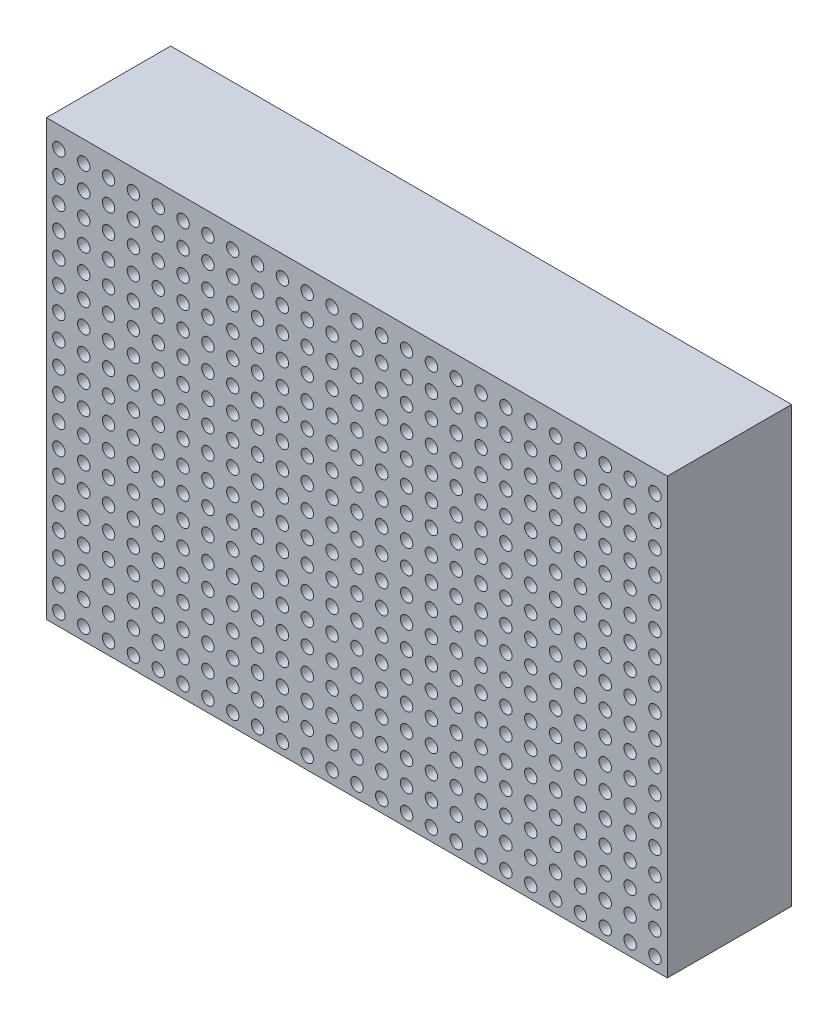
from build123d import *

# Parameters (mm, degrees)
SKETCH1_W           = 50
SKETCH1_H           = 35
BOSS_EXTRUDE1_DEPTH = 10
SKETCH2_R           = 0.5
CUT_EXTRUDE1_DEPTH  = 9.5
LPATTERN1_START     = 0.5
LPATTERN1_OUTLINE_R = 0.5
LPATTERN1_DEPTH     = 9.5


# Read off the part's stored shape, not the designer's step: LPattern1
with BuildPart() as part:
    # Sketch1 → Boss-Extrude1 (new body)
    with BuildSketch(Plane.XY):
        with Locations((25, 17.5)):
            Rectangle(SKETCH1_W, SKETCH1_H)
    extrude(amount=BOSS_EXTRUDE1_DEPTH)

    # Sketch2 → Cut-Extrude1 (cut)
    with BuildSketch(Plane.XY.offset(10)):
        with Locations((1, 1)):
            Circle(SKETCH2_R)
    extrude(amount=-CUT_EXTRUDE1_DEPTH, mode=Mode.SUBTRACT)

    # LPattern1 outline → LPattern1 (cut)
    with BuildSketch(Plane.XY.offset(LPATTERN1_START)):
        with Locations((49, 33.3)):
            Circle(LPATTERN1_OUTLINE_R)
        with Locations((49, 31.4)):
            Circle(LPATTERN1_OUTLINE_R)
        with Locations((49, 29.5)):
            Circle(LPATTERN1_OUTLINE_R)
        with Locations((49, 27.6)):
            Circle(LPATTERN1_OUTLINE_R)
        with Locations((49, 25.7)):
            Circle(LPATTERN1_OUTLINE_R)
        with Locations((49, 23.8)):
            Circle(LPATTERN1_OUTLINE_R)
        with Locations((49, 21.9)):
            Circle(LPATTERN1_OUTLINE_R)
        with Locations((49, 20)):
            Circle(LPATTERN1_OUTLINE_R)
        with Locations((49, 18.1)):
            Circle(LPATTERN1_OUTLINE_R)
        with Locations((49, 16.2)):
            Circle(LPATTERN1_OUTLINE_R)
        with Locations((49, 14.3)):
            Circle(LPATTERN1_OUTLINE_R)
        with Locations((49, 12.4)):
            Circle(LPATTERN1_OUTLINE_R)
        with Locations((49, 10.5)):
            Circle(LPATTERN1_OUTLINE_R)
        with Locations((49, 8.6)):
            Circle(LPATTERN1_OUTLINE_R)
        with Locations((49, 6.7)):
            Circle(LPATTERN1_OUTLINE_R)
        with Locations((49, 4.8)):
            Circle(LPATTERN1_OUTLINE_R)
        with Locations((49, 2.9)):
            Circle(LPATTERN1_OUTLINE_R)
        with Locations((49, 1)):
            Circle(LPATTERN1_OUTLINE_R)
        with Locations((47, 33.3)):
            Circle(LPATTERN1_OUTLINE_R)
        with Locations((47, 31.4)):
            Circle(LPATTERN1_OUTLINE_R)
        with Locations((47, 29.5)):
            Circle(LPATTERN1_OUTLINE_R)
        with Locations((47, 27.6)):
            Circle(LPATTERN1_OUTLINE_R)
        with Locations((47, 25.7)):
            Circle(LPATTERN1_OUTLINE_R)
        with Locations((47, 23.8)):
            Circle(LPATTERN1_OUTLINE_R)
        with Locations((47, 21.9)):
            Circle(LPATTERN1_OUTLINE_R)
        with Locations((47, 20)):
            Circle(LPATTERN1_OUTLINE_R)
        with Locations((47, 18.1)):
            Circle(LPATTERN1_OUTLINE_R)
        with Locations((47, 16.2)):
            Circle(LPATTERN1_OUTLINE_R)
        with Locations((47, 14.3)):
            Circle(LPATTERN1_OUTLINE_R)
        with Locations((47, 12.4)):
            Circle(LPATTERN1_OUTLINE_R)
        with Locations((47, 10.5)):
            Circle(LPATTERN1_OUTLINE_R)
        with Locations((47, 8.6)):
            Circle(LPATTERN1_OUTLINE_R)
        with Locations((47, 6.7)):
            Circle(LPATTERN1_OUTLINE_R)
        with Locations((47, 4.8)):
            Circle(LPATTERN1_OUTLINE_R)
        with Locations((47, 2.9)):
            Circle(LPATTERN1_OUTLINE_R)
        with Locations((47, 1)):
            Circle(LPATTERN1_OUTLINE_R)
        with Locations((45, 33.3)):
            Circle(LPATTERN1_OUTLINE_R)
        with Locations((45, 31.4)):
            Circle(LPATTERN1_OUTLINE_R)
        with Locations((45, 29.5)):
            Circle(LPATTERN1_OUTLINE_R)
        with Locations((45, 27.6)):
            Circle(LPATTERN1_OUTLINE_R)
        with Locations((45, 25.7)):
            Circle(LPATTERN1_OUTLINE_R)
        with Locations((45, 23.8)):
            Circle(LPATTERN1_OUTLINE_R)
        with Locations((45, 21.9)):
            Circle(LPATTERN1_OUTLINE_R)
        with Locations((45, 20)):
            Circle(LPATTERN1_OUTLINE_R)
        with Locations((45, 18.1)):
            Circle(LPATTERN1_OUTLINE_R)
        with Locations((45, 16.2)):
            Circle(LPATTERN1_OUTLINE_R)
        with Locations((45, 14.3)):
            Circle(LPATTERN1_OUTLINE_R)
        with Locations((45, 12.4)):
            Circle(LPATTERN1_OUTLINE_R)
        with Locations((45, 10.5)):
            Circle(LPATTERN1_OUTLINE_R)
        with Locations((45, 8.6)):
            Circle(LPATTERN1_OUTLINE_R)
        with Locations((45, 6.7)):
            Circle(LPATTERN1_OUTLINE_R)
        with Locations((45, 4.8)):
            Circle(LPATTERN1_OUTLINE_R)
        with Locations((45, 2.9)):
            Circle(LPATTERN1_OUTLINE_R)
        with Locations((45, 1)):
            Circle(LPATTERN1_OUTLINE_R)
        with Locations((43, 33.3)):
            Circle(LPATTERN1_OUTLINE_R)
        with Locations((43, 31.4)):
            Circle(LPATTERN1_OUTLINE_R)
        with Locations((43, 29.5)):
            Circle(LPATTERN1_OUTLINE_R)
        with Locations((43, 27.6)):
            Circle(LPATTERN1_OUTLINE_R)
        with Locations((43, 25.7)):
            Circle(LPATTERN1_OUTLINE_R)
        with Locations((43, 23.8)):
            Circle(LPATTERN1_OUTLINE_R)
        with Locations((43, 21.9)):
            Circle(LPATTERN1_OUTLINE_R)
        with Locations((43, 20)):
            Circle(LPATTERN1_OUTLINE_R)
        with Locations((43, 18.1)):
            Circle(LPATTERN1_OUTLINE_R)
        with Locations((43, 16.2)):
            Circle(LPATTERN1_OUTLINE_R)
        with Locations((43, 14.3)):
            Circle(LPATTERN1_OUTLINE_R)
        with Locations((43, 12.4)):
            Circle(LPATTERN1_OUTLINE_R)
        with Locations((43, 10.5)):
            Circle(LPATTERN1_OUTLINE_R)
        with Locations((43, 8.6)):
            Circle(LPATTERN1_OUTLINE_R)
        with Locations((43, 6.7)):
            Circle(LPATTERN1_OUTLINE_R)
        with Locations((43, 4.8)):
            Circle(LPATTERN1_OUTLINE_R)
        with Locations((43, 2.9)):
            Circle(LPATTERN1_OUTLINE_R)
        with Locations((43, 1)):
            Circle(LPATTERN1_OUTLINE_R)
        with Locations((41, 33.3)):
            Circle(LPATTERN1_OUTLINE_R)
        with Locations((41, 31.4)):
            Circle(LPATTERN1_OUTLINE_R)
        with Locations((41, 29.5)):
            Circle(LPATTERN1_OUTLINE_R)
        with Locations((41, 27.6)):
            Circle(LPATTERN1_OUTLINE_R)
        with Locations((41, 25.7)):
            Circle(LPATTERN1_OUTLINE_R)
        with Locations((41, 23.8)):
            Circle(LPATTERN1_OUTLINE_R)
        with Locations((41, 21.9)):
            Circle(LPATTERN1_OUTLINE_R)
        with Locations((41, 20)):
            Circle(LPATTERN1_OUTLINE_R)
        with Locations((41, 18.1)):
            Circle(LPATTERN1_OUTLINE_R)
        with Locations((41, 16.2)):
            Circle(LPATTERN1_OUTLINE_R)
        with Locations((41, 14.3)):
            Circle(LPATTERN1_OUTLINE_R)
        with Locations((41, 12.4)):
            Circle(LPATTERN1_OUTLINE_R)
        with Locations((41, 10.5)):
            Circle(LPATTERN1_OUTLINE_R)
        with Locations((41, 8.6)):
            Circle(LPATTERN1_OUTLINE_R)
        with Locations((41, 6.7)):
            Circle(LPATTERN1_OUTLINE_R)
        with Locations((41, 4.8)):
            Circle(LPATTERN1_OUTLINE_R)
        with Locations((41, 2.9)):
            Circle(LPATTERN1_OUTLINE_R)
        with Locations((41, 1)):
            Circle(LPATTERN1_OUTLINE_R)
        with Locations((39, 33.3)):
            Circle(LPATTERN1_OUTLINE_R)
        with Locations((39, 31.4)):
            Circle(LPATTERN1_OUTLINE_R)
        with Locations((39, 29.5)):
            Circle(LPATTERN1_OUTLINE_R)
        with Locations((39, 27.6)):
            Circle(LPATTERN1_OUTLINE_R)
        with Locations((39, 25.7)):
            Circle(LPATTERN1_OUTLINE_R)
        with Locations((39, 23.8)):
            Circle(LPATTERN1_OUTLINE_R)
        with Locations((39, 21.9)):
            Circle(LPATTERN1_OUTLINE_R)
        with Locations((39, 20)):
            Circle(LPATTERN1_OUTLINE_R)
        with Locations((39, 18.1)):
            Circle(LPATTERN1_OUTLINE_R)
        with Locations((39, 16.2)):
            Circle(LPATTERN1_OUTLINE_R)
        with Locations((39, 14.3)):
            Circle(LPATTERN1_OUTLINE_R)
        with Locations((39, 12.4)):
            Circle(LPATTERN1_OUTLINE_R)
        with Locations((39, 10.5)):
            Circle(LPATTERN1_OUTLINE_R)
        with Locations((39, 8.6)):
            Circle(LPATTERN1_OUTLINE_R)
        with Locations((39, 6.7)):
            Circle(LPATTERN1_OUTLINE_R)
        with Locations((39, 4.8)):
            Circle(LPATTERN1_OUTLINE_R)
        with Locations((39, 2.9)):
            Circle(LPATTERN1_OUTLINE_R)
        with Locations((39, 1)):
            Circle(LPATTERN1_OUTLINE_R)
        with Locations((37, 33.3)):
            Circle(LPATTERN1_OUTLINE_R)
        with Locations((37, 31.4)):
            Circle(LPATTERN1_OUTLINE_R)
        with Locations((37, 29.5)):
            Circle(LPATTERN1_OUTLINE_R)
        with Locations((37, 27.6)):
            Circle(LPATTERN1_OUTLINE_R)
        with Locations((37, 25.7)):
            Circle(LPATTERN1_OUTLINE_R)
        with Locations((37, 23.8)):
            Circle(LPATTERN1_OUTLINE_R)
        with Locations((37, 21.9)):
            Circle(LPATTERN1_OUTLINE_R)
        with Locations((37, 20)):
            Circle(LPATTERN1_OUTLINE_R)
        with Locations((37, 18.1)):
            Circle(LPATTERN1_OUTLINE_R)
        with Locations((37, 16.2)):
            Circle(LPATTERN1_OUTLINE_R)
        with Locations((37, 14.3)):
            Circle(LPATTERN1_OUTLINE_R)
        with Locations((37, 12.4)):
            Circle(LPATTERN1_OUTLINE_R)
        with Locations((37, 10.5)):
            Circle(LPATTERN1_OUTLINE_R)
        with Locations((37, 8.6)):
            Circle(LPATTERN1_OUTLINE_R)
        with Locations((37, 6.7)):
            Circle(LPATTERN1_OUTLINE_R)
        with Locations((37, 4.8)):
            Circle(LPATTERN1_OUTLINE_R)
        with Locations((37, 2.9)):
            Circle(LPATTERN1_OUTLINE_R)
        with Locations((37, 1)):
            Circle(LPATTERN1_OUTLINE_R)
        with Locations((35, 33.3)):
            Circle(LPATTERN1_OUTLINE_R)
        with Locations((35, 31.4)):
            Circle(LPATTERN1_OUTLINE_R)
        with Locations((35, 29.5)):
            Circle(LPATTERN1_OUTLINE_R)
        with Locations((35, 27.6)):
            Circle(LPATTERN1_OUTLINE_R)
        with Locations((35, 25.7)):
            Circle(LPATTERN1_OUTLINE_R)
        with Locations((35, 23.8)):
            Circle(LPATTERN1_OUTLINE_R)
        with Locations((35, 21.9)):
            Circle(LPATTERN1_OUTLINE_R)
        with Locations((35, 20)):
            Circle(LPATTERN1_OUTLINE_R)
        with Locations((35, 18.1)):
            Circle(LPATTERN1_OUTLINE_R)
        with Locations((35, 16.2)):
            Circle(LPATTERN1_OUTLINE_R)
        with Locations((35, 14.3)):
            Circle(LPATTERN1_OUTLINE_R)
        with Locations((35, 12.4)):
            Circle(LPATTERN1_OUTLINE_R)
        with Locations((35, 10.5)):
            Circle(LPATTERN1_OUTLINE_R)
        with Locations((35, 8.6)):
            Circle(LPATTERN1_OUTLINE_R)
        with Locations((35, 6.7)):
            Circle(LPATTERN1_OUTLINE_R)
        with Locations((35, 4.8)):
            Circle(LPATTERN1_OUTLINE_R)
        with Locations((35, 2.9)):
            Circle(LPATTERN1_OUTLINE_R)
        with Locations((35, 1)):
            Circle(LPATTERN1_OUTLINE_R)
        with Locations((33, 33.3)):
            Circle(LPATTERN1_OUTLINE_R)
        with Locations((33, 31.4)):
            Circle(LPATTERN1_OUTLINE_R)
        with Locations((33, 29.5)):
            Circle(LPATTERN1_OUTLINE_R)
        with Locations((33, 27.6)):
            Circle(LPATTERN1_OUTLINE_R)
        with Locations((33, 25.7)):
            Circle(LPATTERN1_OUTLINE_R)
        with Locations((33, 23.8)):
            Circle(LPATTERN1_OUTLINE_R)
        with Locations((33, 21.9)):
            Circle(LPATTERN1_OUTLINE_R)
        with Locations((33, 20)):
            Circle(LPATTERN1_OUTLINE_R)
        with Locations((33, 18.1)):
            Circle(LPATTERN1_OUTLINE_R)
        with Locations((33, 16.2)):
            Circle(LPATTERN1_OUTLINE_R)
        with Locations((33, 14.3)):
            Circle(LPATTERN1_OUTLINE_R)
        with Locations((33, 12.4)):
            Circle(LPATTERN1_OUTLINE_R)
        with Locations((33, 10.5)):
            Circle(LPATTERN1_OUTLINE_R)
        with Locations((33, 8.6)):
            Circle(LPATTERN1_OUTLINE_R)
        with Locations((33, 6.7)):
            Circle(LPATTERN1_OUTLINE_R)
        with Locations((33, 4.8)):
            Circle(LPATTERN1_OUTLINE_R)
        with Locations((33, 2.9)):
            Circle(LPATTERN1_OUTLINE_R)
        with Locations((33, 1)):
            Circle(LPATTERN1_OUTLINE_R)
        with Locations((31, 33.3)):
            Circle(LPATTERN1_OUTLINE_R)
        with Locations((31, 31.4)):
            Circle(LPATTERN1_OUTLINE_R)
        with Locations((31, 29.5)):
            Circle(LPATTERN1_OUTLINE_R)
        with Locations((31, 27.6)):
            Circle(LPATTERN1_OUTLINE_R)
        with Locations((31, 25.7)):
            Circle(LPATTERN1_OUTLINE_R)
        with Locations((31, 23.8)):
            Circle(LPATTERN1_OUTLINE_R)
        with Locations((31, 21.9)):
            Circle(LPATTERN1_OUTLINE_R)
        with Locations((31, 20)):
            Circle(LPATTERN1_OUTLINE_R)
        with Locations((31, 18.1)):
            Circle(LPATTERN1_OUTLINE_R)
        with Locations((31, 16.2)):
            Circle(LPATTERN1_OUTLINE_R)
        with Locations((31, 14.3)):
            Circle(LPATTERN1_OUTLINE_R)
        with Locations((31, 12.4)):
            Circle(LPATTERN1_OUTLINE_R)
        with Locations((31, 10.5)):
            Circle(LPATTERN1_OUTLINE_R)
        with Locations((31, 8.6)):
            Circle(LPATTERN1_OUTLINE_R)
        with Locations((31, 6.7)):
            Circle(LPATTERN1_OUTLINE_R)
        with Locations((31, 4.8)):
            Circle(LPATTERN1_OUTLINE_R)
        with Locations((31, 2.9)):
            Circle(LPATTERN1_OUTLINE_R)
        with Locations((31, 1)):
            Circle(LPATTERN1_OUTLINE_R)
        with Locations((29, 33.3)):
            Circle(LPATTERN1_OUTLINE_R)
        with Locations((29, 31.4)):
            Circle(LPATTERN1_OUTLINE_R)
        with Locations((29, 29.5)):
            Circle(LPATTERN1_OUTLINE_R)
        with Locations((29, 27.6)):
            Circle(LPATTERN1_OUTLINE_R)
        with Locations((29, 25.7)):
            Circle(LPATTERN1_OUTLINE_R)
        with Locations((29, 23.8)):
            Circle(LPATTERN1_OUTLINE_R)
        with Locations((29, 21.9)):
            Circle(LPATTERN1_OUTLINE_R)
        with Locations((29, 20)):
            Circle(LPATTERN1_OUTLINE_R)
        with Locations((29, 18.1)):
            Circle(LPATTERN1_OUTLINE_R)
        with Locations((29, 16.2)):
            Circle(LPATTERN1_OUTLINE_R)
        with Locations((29, 14.3)):
            Circle(LPATTERN1_OUTLINE_R)
        with Locations((29, 12.4)):
            Circle(LPATTERN1_OUTLINE_R)
        with Locations((29, 10.5)):
            Circle(LPATTERN1_OUTLINE_R)
        with Locations((29, 8.6)):
            Circle(LPATTERN1_OUTLINE_R)
        with Locations((29, 6.7)):
            Circle(LPATTERN1_OUTLINE_R)
        with Locations((29, 4.8)):
            Circle(LPATTERN1_OUTLINE_R)
        with Locations((29, 2.9)):
            Circle(LPATTERN1_OUTLINE_R)
        with Locations((29, 1)):
            Circle(LPATTERN1_OUTLINE_R)
        with Locations((27, 33.3)):
            Circle(LPATTERN1_OUTLINE_R)
        with Locations((27, 31.4)):
            Circle(LPATTERN1_OUTLINE_R)
        with Locations((27, 29.5)):
            Circle(LPATTERN1_OUTLINE_R)
        with Locations((27, 27.6)):
            Circle(LPATTERN1_OUTLINE_R)
        with Locations((27, 25.7)):
            Circle(LPATTERN1_OUTLINE_R)
        with Locations((27, 23.8)):
            Circle(LPATTERN1_OUTLINE_R)
        with Locations((27, 21.9)):
            Circle(LPATTERN1_OUTLINE_R)
        with Locations((27, 20)):
            Circle(LPATTERN1_OUTLINE_R)
        with Locations((27, 18.1)):
            Circle(LPATTERN1_OUTLINE_R)
        with Locations((27, 16.2)):
            Circle(LPATTERN1_OUTLINE_R)
        with Locations((27, 14.3)):
            Circle(LPATTERN1_OUTLINE_R)
        with Locations((27, 12.4)):
            Circle(LPATTERN1_OUTLINE_R)
        with Locations((27, 10.5)):
            Circle(LPATTERN1_OUTLINE_R)
        with Locations((27, 8.6)):
            Circle(LPATTERN1_OUTLINE_R)
        with Locations((27, 6.7)):
            Circle(LPATTERN1_OUTLINE_R)
        with Locations((27, 4.8)):
            Circle(LPATTERN1_OUTLINE_R)
        with Locations((27, 2.9)):
            Circle(LPATTERN1_OUTLINE_R)
        with Locations((27, 1)):
            Circle(LPATTERN1_OUTLINE_R)
        with Locations((25, 33.3)):
            Circle(LPATTERN1_OUTLINE_R)
        with Locations((25, 31.4)):
            Circle(LPATTERN1_OUTLINE_R)
        with Locations((25, 29.5)):
            Circle(LPATTERN1_OUTLINE_R)
        with Locations((25, 27.6)):
            Circle(LPATTERN1_OUTLINE_R)
        with Locations((25, 25.7)):
            Circle(LPATTERN1_OUTLINE_R)
        with Locations((25, 23.8)):
            Circle(LPATTERN1_OUTLINE_R)
        with Locations((25, 21.9)):
            Circle(LPATTERN1_OUTLINE_R)
        with Locations((25, 20)):
            Circle(LPATTERN1_OUTLINE_R)
        with Locations((25, 18.1)):
            Circle(LPATTERN1_OUTLINE_R)
        with Locations((25, 16.2)):
            Circle(LPATTERN1_OUTLINE_R)
        with Locations((25, 14.3)):
            Circle(LPATTERN1_OUTLINE_R)
        with Locations((25, 12.4)):
            Circle(LPATTERN1_OUTLINE_R)
        with Locations((25, 10.5)):
            Circle(LPATTERN1_OUTLINE_R)
        with Locations((25, 8.6)):
            Circle(LPATTERN1_OUTLINE_R)
        with Locations((25, 6.7)):
            Circle(LPATTERN1_OUTLINE_R)
        with Locations((25, 4.8)):
            Circle(LPATTERN1_OUTLINE_R)
        with Locations((25, 2.9)):
            Circle(LPATTERN1_OUTLINE_R)
        with Locations((25, 1)):
            Circle(LPATTERN1_OUTLINE_R)
        with Locations((23, 33.3)):
            Circle(LPATTERN1_OUTLINE_R)
        with Locations((23, 31.4)):
            Circle(LPATTERN1_OUTLINE_R)
        with Locations((23, 29.5)):
            Circle(LPATTERN1_OUTLINE_R)
        with Locations((23, 27.6)):
            Circle(LPATTERN1_OUTLINE_R)
        with Locations((23, 25.7)):
            Circle(LPATTERN1_OUTLINE_R)
        with Locations((23, 23.8)):
            Circle(LPATTERN1_OUTLINE_R)
        with Locations((23, 21.9)):
            Circle(LPATTERN1_OUTLINE_R)
        with Locations((23, 20)):
            Circle(LPATTERN1_OUTLINE_R)
        with Locations((23, 18.1)):
            Circle(LPATTERN1_OUTLINE_R)
        with Locations((23, 16.2)):
            Circle(LPATTERN1_OUTLINE_R)
        with Locations((23, 14.3)):
            Circle(LPATTERN1_OUTLINE_R)
        with Locations((23, 12.4)):
            Circle(LPATTERN1_OUTLINE_R)
        with Locations((23, 10.5)):
            Circle(LPATTERN1_OUTLINE_R)
        with Locations((23, 8.6)):
            Circle(LPATTERN1_OUTLINE_R)
        with Locations((23, 6.7)):
            Circle(LPATTERN1_OUTLINE_R)
        with Locations((23, 4.8)):
            Circle(LPATTERN1_OUTLINE_R)
        with Locations((23, 2.9)):
            Circle(LPATTERN1_OUTLINE_R)
        with Locations((23, 1)):
            Circle(LPATTERN1_OUTLINE_R)
        with Locations((21, 33.3)):
            Circle(LPATTERN1_OUTLINE_R)
        with Locations((21, 31.4)):
            Circle(LPATTERN1_OUTLINE_R)
        with Locations((21, 29.5)):
            Circle(LPATTERN1_OUTLINE_R)
        with Locations((21, 27.6)):
            Circle(LPATTERN1_OUTLINE_R)
        with Locations((21, 25.7)):
            Circle(LPATTERN1_OUTLINE_R)
        with Locations((21, 23.8)):
            Circle(LPATTERN1_OUTLINE_R)
        with Locations((21, 21.9)):
            Circle(LPATTERN1_OUTLINE_R)
        with Locations((21, 20)):
            Circle(LPATTERN1_OUTLINE_R)
        with Locations((21, 18.1)):
            Circle(LPATTERN1_OUTLINE_R)
        with Locations((21, 16.2)):
            Circle(LPATTERN1_OUTLINE_R)
        with Locations((21, 14.3)):
            Circle(LPATTERN1_OUTLINE_R)
        with Locations((21, 12.4)):
            Circle(LPATTERN1_OUTLINE_R)
        with Locations((21, 10.5)):
            Circle(LPATTERN1_OUTLINE_R)
        with Locations((21, 8.6)):
            Circle(LPATTERN1_OUTLINE_R)
        with Locations((21, 6.7)):
            Circle(LPATTERN1_OUTLINE_R)
        with Locations((21, 4.8)):
            Circle(LPATTERN1_OUTLINE_R)
        with Locations((21, 2.9)):
            Circle(LPATTERN1_OUTLINE_R)
        with Locations((21, 1)):
            Circle(LPATTERN1_OUTLINE_R)
        with Locations((19, 33.3)):
            Circle(LPATTERN1_OUTLINE_R)
        with Locations((19, 31.4)):
            Circle(LPATTERN1_OUTLINE_R)
        with Locations((19, 29.5)):
            Circle(LPATTERN1_OUTLINE_R)
        with Locations((19, 27.6)):
            Circle(LPATTERN1_OUTLINE_R)
        with Locations((19, 25.7)):
            Circle(LPATTERN1_OUTLINE_R)
        with Locations((19, 23.8)):
            Circle(LPATTERN1_OUTLINE_R)
        with Locations((19, 21.9)):
            Circle(LPATTERN1_OUTLINE_R)
        with Locations((19, 20)):
            Circle(LPATTERN1_OUTLINE_R)
        with Locations((19, 18.1)):
            Circle(LPATTERN1_OUTLINE_R)
        with Locations((19, 16.2)):
            Circle(LPATTERN1_OUTLINE_R)
        with Locations((19, 14.3)):
            Circle(LPATTERN1_OUTLINE_R)
        with Locations((19, 12.4)):
            Circle(LPATTERN1_OUTLINE_R)
        with Locations((19, 10.5)):
            Circle(LPATTERN1_OUTLINE_R)
        with Locations((19, 8.6)):
            Circle(LPATTERN1_OUTLINE_R)
        with Locations((19, 6.7)):
            Circle(LPATTERN1_OUTLINE_R)
        with Locations((19, 4.8)):
            Circle(LPATTERN1_OUTLINE_R)
        with Locations((19, 2.9)):
            Circle(LPATTERN1_OUTLINE_R)
        with Locations((19, 1)):
            Circle(LPATTERN1_OUTLINE_R)
        with Locations((17, 33.3)):
            Circle(LPATTERN1_OUTLINE_R)
        with Locations((17, 31.4)):
            Circle(LPATTERN1_OUTLINE_R)
        with Locations((17, 29.5)):
            Circle(LPATTERN1_OUTLINE_R)
        with Locations((17, 27.6)):
            Circle(LPATTERN1_OUTLINE_R)
        with Locations((17, 25.7)):
            Circle(LPATTERN1_OUTLINE_R)
        with Locations((17, 23.8)):
            Circle(LPATTERN1_OUTLINE_R)
        with Locations((17, 21.9)):
            Circle(LPATTERN1_OUTLINE_R)
        with Locations((17, 20)):
            Circle(LPATTERN1_OUTLINE_R)
        with Locations((17, 18.1)):
            Circle(LPATTERN1_OUTLINE_R)
        with Locations((17, 16.2)):
            Circle(LPATTERN1_OUTLINE_R)
        with Locations((17, 14.3)):
            Circle(LPATTERN1_OUTLINE_R)
        with Locations((17, 12.4)):
            Circle(LPATTERN1_OUTLINE_R)
        with Locations((17, 10.5)):
            Circle(LPATTERN1_OUTLINE_R)
        with Locations((17, 8.6)):
            Circle(LPATTERN1_OUTLINE_R)
        with Locations((17, 6.7)):
            Circle(LPATTERN1_OUTLINE_R)
        with Locations((17, 4.8)):
            Circle(LPATTERN1_OUTLINE_R)
        with Locations((17, 2.9)):
            Circle(LPATTERN1_OUTLINE_R)
        with Locations((17, 1)):
            Circle(LPATTERN1_OUTLINE_R)
        with Locations((15, 33.3)):
            Circle(LPATTERN1_OUTLINE_R)
        with Locations((15, 31.4)):
            Circle(LPATTERN1_OUTLINE_R)
        with Locations((15, 29.5)):
            Circle(LPATTERN1_OUTLINE_R)
        with Locations((15, 27.6)):
            Circle(LPATTERN1_OUTLINE_R)
        with Locations((15, 25.7)):
            Circle(LPATTERN1_OUTLINE_R)
        with Locations((15, 23.8)):
            Circle(LPATTERN1_OUTLINE_R)
        with Locations((15, 21.9)):
            Circle(LPATTERN1_OUTLINE_R)
        with Locations((15, 20)):
            Circle(LPATTERN1_OUTLINE_R)
        with Locations((15, 18.1)):
            Circle(LPATTERN1_OUTLINE_R)
        with Locations((15, 16.2)):
            Circle(LPATTERN1_OUTLINE_R)
        with Locations((15, 14.3)):
            Circle(LPATTERN1_OUTLINE_R)
        with Locations((15, 12.4)):
            Circle(LPATTERN1_OUTLINE_R)
        with Locations((15, 10.5)):
            Circle(LPATTERN1_OUTLINE_R)
        with Locations((15, 8.6)):
            Circle(LPATTERN1_OUTLINE_R)
        with Locations((15, 6.7)):
            Circle(LPATTERN1_OUTLINE_R)
        with Locations((15, 4.8)):
            Circle(LPATTERN1_OUTLINE_R)
        with Locations((15, 2.9)):
            Circle(LPATTERN1_OUTLINE_R)
        with Locations((15, 1)):
            Circle(LPATTERN1_OUTLINE_R)
        with Locations((13, 33.3)):
            Circle(LPATTERN1_OUTLINE_R)
        with Locations((13, 31.4)):
            Circle(LPATTERN1_OUTLINE_R)
        with Locations((13, 29.5)):
            Circle(LPATTERN1_OUTLINE_R)
        with Locations((13, 27.6)):
            Circle(LPATTERN1_OUTLINE_R)
        with Locations((13, 25.7)):
            Circle(LPATTERN1_OUTLINE_R)
        with Locations((13, 23.8)):
            Circle(LPATTERN1_OUTLINE_R)
        with Locations((13, 21.9)):
            Circle(LPATTERN1_OUTLINE_R)
        with Locations((13, 20)):
            Circle(LPATTERN1_OUTLINE_R)
        with Locations((13, 18.1)):
            Circle(LPATTERN1_OUTLINE_R)
        with Locations((13, 16.2)):
            Circle(LPATTERN1_OUTLINE_R)
        with Locations((13, 14.3)):
            Circle(LPATTERN1_OUTLINE_R)
        with Locations((13, 12.4)):
            Circle(LPATTERN1_OUTLINE_R)
        with Locations((13, 10.5)):
            Circle(LPATTERN1_OUTLINE_R)
        with Locations((13, 8.6)):
            Circle(LPATTERN1_OUTLINE_R)
        with Locations((13, 6.7)):
            Circle(LPATTERN1_OUTLINE_R)
        with Locations((13, 4.8)):
            Circle(LPATTERN1_OUTLINE_R)
        with Locations((13, 2.9)):
            Circle(LPATTERN1_OUTLINE_R)
        with Locations((13, 1)):
            Circle(LPATTERN1_OUTLINE_R)
        with Locations((11, 33.3)):
            Circle(LPATTERN1_OUTLINE_R)
        with Locations((11, 31.4)):
            Circle(LPATTERN1_OUTLINE_R)
        with Locations((11, 29.5)):
            Circle(LPATTERN1_OUTLINE_R)
        with Locations((11, 27.6)):
            Circle(LPATTERN1_OUTLINE_R)
        with Locations((11, 25.7)):
            Circle(LPATTERN1_OUTLINE_R)
        with Locations((11, 23.8)):
            Circle(LPATTERN1_OUTLINE_R)
        with Locations((11, 21.9)):
            Circle(LPATTERN1_OUTLINE_R)
        with Locations((11, 20)):
            Circle(LPATTERN1_OUTLINE_R)
        with Locations((11, 18.1)):
            Circle(LPATTERN1_OUTLINE_R)
        with Locations((11, 16.2)):
            Circle(LPATTERN1_OUTLINE_R)
        with Locations((11, 14.3)):
            Circle(LPATTERN1_OUTLINE_R)
        with Locations((11, 12.4)):
            Circle(LPATTERN1_OUTLINE_R)
        with Locations((11, 10.5)):
            Circle(LPATTERN1_OUTLINE_R)
        with Locations((11, 8.6)):
            Circle(LPATTERN1_OUTLINE_R)
        with Locations((11, 6.7)):
            Circle(LPATTERN1_OUTLINE_R)
        with Locations((11, 4.8)):
            Circle(LPATTERN1_OUTLINE_R)
        with Locations((11, 2.9)):
            Circle(LPATTERN1_OUTLINE_R)
        with Locations((11, 1)):
            Circle(LPATTERN1_OUTLINE_R)
        with Locations((9, 33.3)):
            Circle(LPATTERN1_OUTLINE_R)
        with Locations((9, 31.4)):
            Circle(LPATTERN1_OUTLINE_R)
        with Locations((9, 29.5)):
            Circle(LPATTERN1_OUTLINE_R)
        with Locations((9, 27.6)):
            Circle(LPATTERN1_OUTLINE_R)
        with Locations((9, 25.7)):
            Circle(LPATTERN1_OUTLINE_R)
        with Locations((9, 23.8)):
            Circle(LPATTERN1_OUTLINE_R)
        with Locations((9, 21.9)):
            Circle(LPATTERN1_OUTLINE_R)
        with Locations((9, 20)):
            Circle(LPATTERN1_OUTLINE_R)
        with Locations((9, 18.1)):
            Circle(LPATTERN1_OUTLINE_R)
        with Locations((9, 16.2)):
            Circle(LPATTERN1_OUTLINE_R)
        with Locations((9, 14.3)):
            Circle(LPATTERN1_OUTLINE_R)
        with Locations((9, 12.4)):
            Circle(LPATTERN1_OUTLINE_R)
        with Locations((9, 10.5)):
            Circle(LPATTERN1_OUTLINE_R)
        with Locations((9, 8.6)):
            Circle(LPATTERN1_OUTLINE_R)
        with Locations((9, 6.7)):
            Circle(LPATTERN1_OUTLINE_R)
        with Locations((9, 4.8)):
            Circle(LPATTERN1_OUTLINE_R)
        with Locations((9, 2.9)):
            Circle(LPATTERN1_OUTLINE_R)
        with Locations((9, 1)):
            Circle(LPATTERN1_OUTLINE_R)
        with Locations((7, 33.3)):
            Circle(LPATTERN1_OUTLINE_R)
        with Locations((7, 31.4)):
            Circle(LPATTERN1_OUTLINE_R)
        with Locations((7, 29.5)):
            Circle(LPATTERN1_OUTLINE_R)
        with Locations((7, 27.6)):
            Circle(LPATTERN1_OUTLINE_R)
        with Locations((7, 25.7)):
            Circle(LPATTERN1_OUTLINE_R)
        with Locations((7, 23.8)):
            Circle(LPATTERN1_OUTLINE_R)
        with Locations((7, 21.9)):
            Circle(LPATTERN1_OUTLINE_R)
        with Locations((7, 20)):
            Circle(LPATTERN1_OUTLINE_R)
        with Locations((7, 18.1)):
            Circle(LPATTERN1_OUTLINE_R)
        with Locations((7, 16.2)):
            Circle(LPATTERN1_OUTLINE_R)
        with Locations((7, 14.3)):
            Circle(LPATTERN1_OUTLINE_R)
        with Locations((7, 12.4)):
            Circle(LPATTERN1_OUTLINE_R)
        with Locations((7, 10.5)):
            Circle(LPATTERN1_OUTLINE_R)
        with Locations((7, 8.6)):
            Circle(LPATTERN1_OUTLINE_R)
        with Locations((7, 6.7)):
            Circle(LPATTERN1_OUTLINE_R)
        with Locations((7, 4.8)):
            Circle(LPATTERN1_OUTLINE_R)
        with Locations((7, 2.9)):
            Circle(LPATTERN1_OUTLINE_R)
        with Locations((7, 1)):
            Circle(LPATTERN1_OUTLINE_R)
        with Locations((5, 33.3)):
            Circle(LPATTERN1_OUTLINE_R)
        with Locations((5, 31.4)):
            Circle(LPATTERN1_OUTLINE_R)
        with Locations((5, 29.5)):
            Circle(LPATTERN1_OUTLINE_R)
        with Locations((5, 27.6)):
            Circle(LPATTERN1_OUTLINE_R)
        with Locations((5, 25.7)):
            Circle(LPATTERN1_OUTLINE_R)
        with Locations((5, 23.8)):
            Circle(LPATTERN1_OUTLINE_R)
        with Locations((5, 21.9)):
            Circle(LPATTERN1_OUTLINE_R)
        with Locations((5, 20)):
            Circle(LPATTERN1_OUTLINE_R)
        with Locations((5, 18.1)):
            Circle(LPATTERN1_OUTLINE_R)
        with Locations((5, 16.2)):
            Circle(LPATTERN1_OUTLINE_R)
        with Locations((5, 14.3)):
            Circle(LPATTERN1_OUTLINE_R)
        with Locations((5, 12.4)):
            Circle(LPATTERN1_OUTLINE_R)
        with Locations((5, 10.5)):
            Circle(LPATTERN1_OUTLINE_R)
        with Locations((5, 8.6)):
            Circle(LPATTERN1_OUTLINE_R)
        with Locations((5, 6.7)):
            Circle(LPATTERN1_OUTLINE_R)
        with Locations((5, 4.8)):
            Circle(LPATTERN1_OUTLINE_R)
        with Locations((5, 2.9)):
            Circle(LPATTERN1_OUTLINE_R)
        with Locations((5, 1)):
            Circle(LPATTERN1_OUTLINE_R)
        with Locations((3, 33.3)):
            Circle(LPATTERN1_OUTLINE_R)
        with Locations((3, 31.4)):
            Circle(LPATTERN1_OUTLINE_R)
        with Locations((3, 29.5)):
            Circle(LPATTERN1_OUTLINE_R)
        with Locations((3, 27.6)):
            Circle(LPATTERN1_OUTLINE_R)
        with Locations((3, 25.7)):
            Circle(LPATTERN1_OUTLINE_R)
        with Locations((3, 23.8)):
            Circle(LPATTERN1_OUTLINE_R)
        with Locations((3, 21.9)):
            Circle(LPATTERN1_OUTLINE_R)
        with Locations((3, 20)):
            Circle(LPATTERN1_OUTLINE_R)
        with Locations((3, 18.1)):
            Circle(LPATTERN1_OUTLINE_R)
        with Locations((3, 16.2)):
            Circle(LPATTERN1_OUTLINE_R)
        with Locations((3, 14.3)):
            Circle(LPATTERN1_OUTLINE_R)
        with Locations((3, 12.4)):
            Circle(LPATTERN1_OUTLINE_R)
        with Locations((3, 10.5)):
            Circle(LPATTERN1_OUTLINE_R)
        with Locations((3, 8.6)):
            Circle(LPATTERN1_OUTLINE_R)
        with Locations((3, 6.7)):
            Circle(LPATTERN1_OUTLINE_R)
        with Locations((3, 4.8)):
            Circle(LPATTERN1_OUTLINE_R)
        with Locations((3, 2.9)):
            Circle(LPATTERN1_OUTLINE_R)
        with Locations((3, 1)):
            Circle(LPATTERN1_OUTLINE_R)
        with Locations((1, 33.3)):
            Circle(LPATTERN1_OUTLINE_R)
        with Locations((1, 31.4)):
            Circle(LPATTERN1_OUTLINE_R)
        with Locations((1, 29.5)):
            Circle(LPATTERN1_OUTLINE_R)
        with Locations((1, 27.6)):
            Circle(LPATTERN1_OUTLINE_R)
        with Locations((1, 25.7)):
            Circle(LPATTERN1_OUTLINE_R)
        with Locations((1, 23.8)):
            Circle(LPATTERN1_OUTLINE_R)
        with Locations((1, 21.9)):
            Circle(LPATTERN1_OUTLINE_R)
        with Locations((1, 20)):
            Circle(LPATTERN1_OUTLINE_R)
        with Locations((1, 18.1)):
            Circle(LPATTERN1_OUTLINE_R)
        with Locations((1, 16.2)):
            Circle(LPATTERN1_OUTLINE_R)
        with Locations((1, 14.3)):
            Circle(LPATTERN1_OUTLINE_R)
        with Locations((1, 12.4)):
            Circle(LPATTERN1_OUTLINE_R)
        with Locations((1, 10.5)):
            Circle(LPATTERN1_OUTLINE_R)
        with Locations((1, 8.6)):
            Circle(LPATTERN1_OUTLINE_R)
        with Locations((1, 6.7)):
            Circle(LPATTERN1_OUTLINE_R)
        with Locations((1, 4.8)):
            Circle(LPATTERN1_OUTLINE_R)
        with Locations((1, 2.9)):
            Circle(LPATTERN1_OUTLINE_R)
    extrude(amount=LPATTERN1_DEPTH, mode=Mode.SUBTRACT)


solid = part.part
